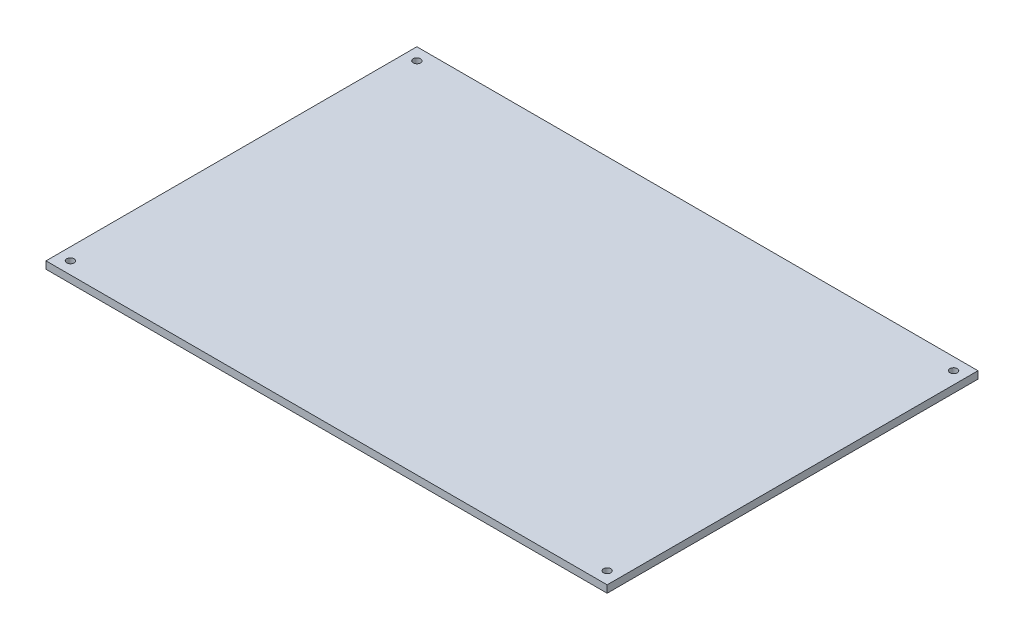
from build123d import *

# Parameters (mm, degrees)
SKETCH_1_W          = 230
SKETCH_1_H          = 152
EXTRUDE_1_DEPTH     = 3
SKETCH_2_R          = 1.5
CUT_EXTRUDE_1_DEPTH = 3


with BuildPart() as part:
    # Эскиз1 → Бобышка-Вытянуть1 (new body)
    with BuildSketch(Plane(origin=(0, 0, 0), x_dir=(1, 0, 0), z_dir=(0, 1, 0))):
        with Locations((-38.903225806, -30.5)):
            Rectangle(SKETCH_1_W, SKETCH_1_H)
    extrude(amount=EXTRUDE_1_DEPTH)

    # Эскиз2 → Вырез-Вытянуть1 (cut)
    with BuildSketch(Plane(origin=(0, 3, 0), x_dir=(1, 0, 0), z_dir=(0, 1, 0))):
        with Locations((-148.903225806, 40.5)):
            Circle(SKETCH_2_R)
        with Locations((71.096774194, 40.5)):
            Circle(SKETCH_2_R)
        with Locations((71.096774194, -101.5)):
            Circle(SKETCH_2_R)
        with Locations((-148.903225806, -101.5)):
            Circle(SKETCH_2_R)
    extrude(amount=-CUT_EXTRUDE_1_DEPTH, mode=Mode.SUBTRACT)


solid = part.part
